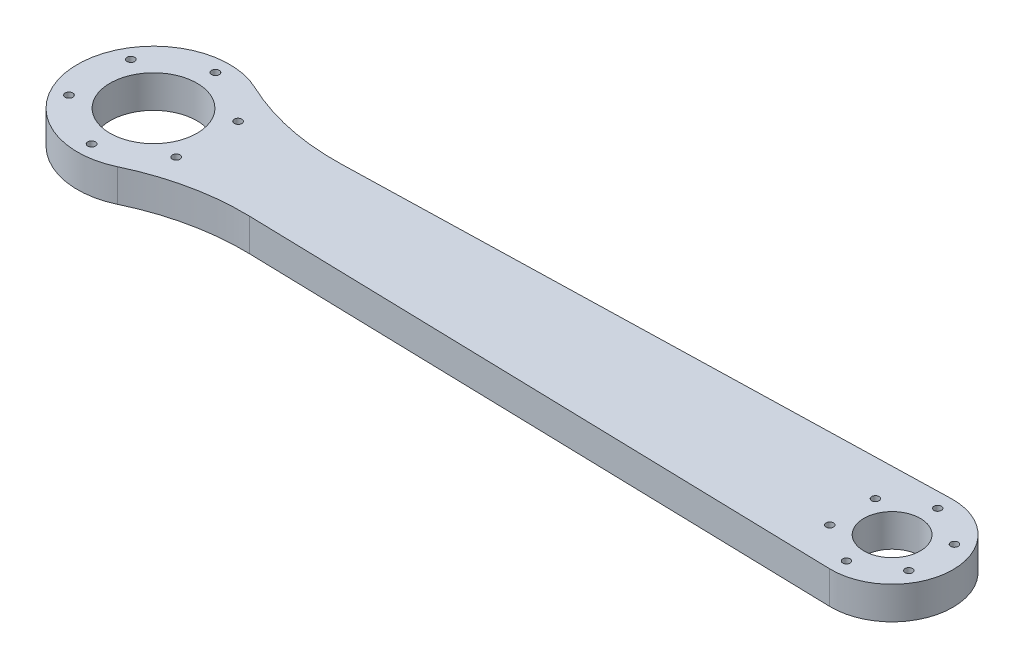
from build123d import *

# Parameters (mm, degrees)
SKETCH_1_R      = 20
SKETCH_1_R_2    = 13
SKETCH_1_R_3    = 1.7
SKETCH_1_R_4    = 1.75
EXTRUDE_1_DEPTH = 15


with BuildPart() as part:
    # 草图1 → 凸台-拉伸1 (new body)
    with BuildSketch(Plane(origin=(0, 0, 0), x_dir=(1, 0, 0), z_dir=(0, 1, 0))):
        with BuildLine():
            Line((65.196415688, 20.938478113), (339.27978891, 27.990735896))
            ThreePointArc((339.27978891, 27.990735896), (368, 0), (339.27978891, -27.990735896))
            Line((339.27978891, -27.990735896), (65.196415688, -20.938478113))
            ThreePointArc((65.196415688, -20.938478113), (39.495702891, -23.306065445), (15.054107063, -31.597054618))
            ThreePointArc((15.054107063, -31.597054618), (-35, 0), (15.054107063, 31.597054618))
            ThreePointArc((15.054107063, 31.597054618), (39.495702891, 23.306065445), (65.196415688, 20.938478113))
        make_face()
        Circle(SKETCH_1_R, mode=Mode.SUBTRACT)
        with Locations((340, 0)):
            Circle(SKETCH_1_R_2, mode=Mode.SUBTRACT)
        with Locations((340, 21)):
            Circle(SKETCH_1_R_3, mode=Mode.SUBTRACT)
        with Locations((358.186533479, 10.5)):
            Circle(SKETCH_1_R_3, mode=Mode.SUBTRACT)
        with Locations((358.186533479, -10.5)):
            Circle(SKETCH_1_R_3, mode=Mode.SUBTRACT)
        with Locations((340, -21)):
            Circle(SKETCH_1_R_3, mode=Mode.SUBTRACT)
        with Locations((321.813466521, -10.5)):
            Circle(SKETCH_1_R_3, mode=Mode.SUBTRACT)
        with Locations((321.813466521, 10.5)):
            Circle(SKETCH_1_R_3, mode=Mode.SUBTRACT)
        with Locations((0, 28.5)):
            Circle(SKETCH_1_R_4, mode=Mode.SUBTRACT)
        with Locations((-24.681724008, 14.25)):
            Circle(SKETCH_1_R_4, mode=Mode.SUBTRACT)
        with Locations((-24.681724008, -14.25)):
            Circle(SKETCH_1_R_4, mode=Mode.SUBTRACT)
        with Locations((0, -28.5)):
            Circle(SKETCH_1_R_4, mode=Mode.SUBTRACT)
        with Locations((24.681724008, -14.25)):
            Circle(SKETCH_1_R_4, mode=Mode.SUBTRACT)
        with Locations((24.681724008, 14.25)):
            Circle(SKETCH_1_R_4, mode=Mode.SUBTRACT)
    extrude(amount=EXTRUDE_1_DEPTH)


solid = part.part
